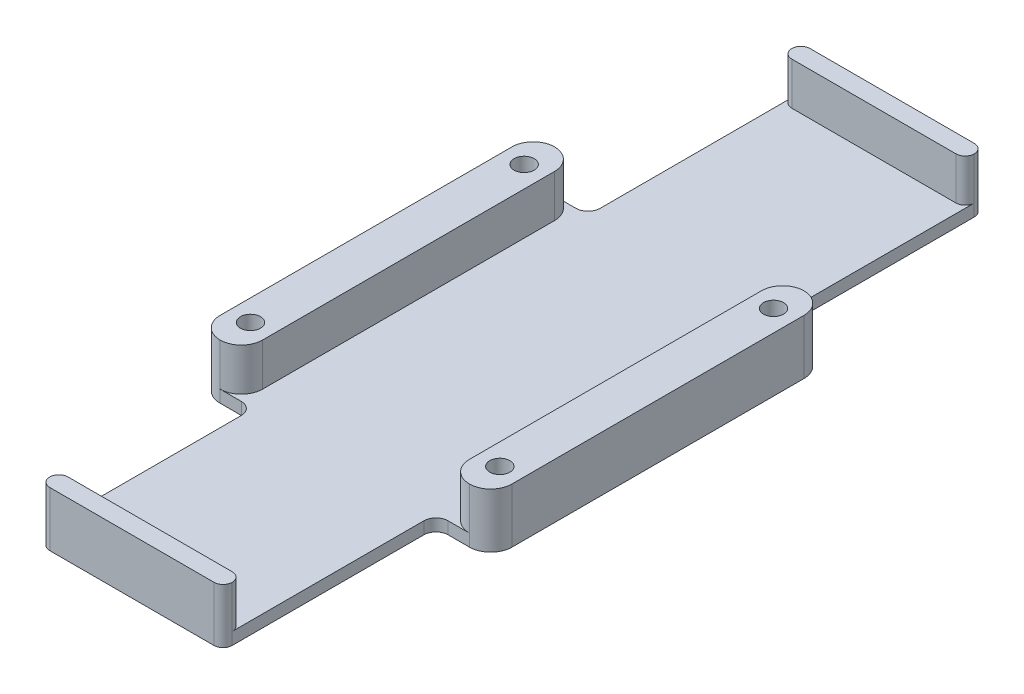
from build123d import *

# Parameters (mm, degrees)
SKETCH_1_W             = 48
SKETCH_1_H             = 125
EXTRUDE_403_DEPTH      = 2
SKETCH_2_W             = 9
SKETCH_2_H             = 35
CUT_EXTRUDE_733_DEPTH  = 67.979474468
SKETCH_3_W             = 7
SKETCH_3_H             = 55
EXTRUDE_1088_DEPTH     = 7
SKETCH_4_W             = 30
SKETCH_4_H             = 3
EXTRUDE_1396_DEPTH     = 7
SKETCH_5_R             = 1.65
CUT_EXTRUDE_1704_DEPTH = 68.551831951
SKETCH_7_R             = 3
CUT_EXTRUDE_2019_DEPTH = 4
CHAMFER_1_SIZE         = 1.5
FILLET_1_R             = 1.5
FILLET_2_R             = 2
FILLET_3_R             = 3.5


# Some blends are built 0.0001 mm under size
with BuildPart() as part:
    # Эскиз1 → Extrude 403 (new body)
    with BuildSketch(Plane(origin=(0, 0, 0), x_dir=(1, 0, 0), z_dir=(0, 1, 0))):
        Rectangle(SKETCH_1_W, SKETCH_1_H)
    extrude(amount=EXTRUDE_403_DEPTH)

    # Эскиз2 → Cut-Extrude 733 (cut, through all)
    with BuildSketch(Plane(origin=(0, 2, 0), x_dir=(1, 0, 0), z_dir=(0, 1, 0))):
        with Locations((-19.5, 45)):
            Rectangle(SKETCH_2_W, SKETCH_2_H)
        with Locations((19.5, 45)):
            Rectangle(SKETCH_2_W, SKETCH_2_H)
        with Locations((19.5, -45)):
            Rectangle(SKETCH_2_W, SKETCH_2_H)
        with Locations((-19.5, -45)):
            Rectangle(SKETCH_2_W, SKETCH_2_H)
    extrude(amount=-CUT_EXTRUDE_733_DEPTH, mode=Mode.SUBTRACT)

    # Эскиз3 → Extrude 1088 (add)
    with BuildSketch(Plane(origin=(0, 2, 0), x_dir=(1, 0, 0), z_dir=(0, 1, 0))):
        with Locations((-20.5, 0)):
            Rectangle(SKETCH_3_W, SKETCH_3_H)
        with Locations((20.5, 0)):
            Rectangle(SKETCH_3_W, SKETCH_3_H)
    extrude(amount=EXTRUDE_1088_DEPTH)

    # Эскиз4 → Extrude 1396 (add)
    with BuildSketch(Plane(origin=(0, 2, 0), x_dir=(1, 0, 0), z_dir=(0, 1, 0))):
        with Locations((0, 61)):
            Rectangle(SKETCH_4_W, SKETCH_4_H)
        with Locations((0, -61)):
            Rectangle(SKETCH_4_W, SKETCH_4_H)
    extrude(amount=EXTRUDE_1396_DEPTH)

    # Эскиз5 → Cut-Extrude 1704 (cut, through all)
    with BuildSketch(Plane(origin=(0, 9, 0), x_dir=(1, 0, 0), z_dir=(0, 1, 0))):
        with Locations(Location((-20.5, 22.5, 0), (0, 0, 270))):
            Circle(SKETCH_5_R)
        with Locations(Location((-20.5, -22.5, 0), (0, 0, 270))):
            Circle(SKETCH_5_R)
        with Locations(Location((20.5, -22.5, 0), (0, 0, 270))):
            Circle(SKETCH_5_R)
        with Locations(Location((20.5, 22.5, 0), (0, 0, 270))):
            Circle(SKETCH_5_R)
    extrude(amount=-CUT_EXTRUDE_1704_DEPTH, mode=Mode.SUBTRACT)

    # Эскиз7 → Cut-Extrude 2019 (cut)
    with BuildSketch(Plane.XZ):
        with Locations(Location((-20.5, 22.5, 0), (0, 0, 270))):
            Circle(SKETCH_7_R)
        with Locations(Location((-20.5, -22.5, 0), (0, 0, 270))):
            Circle(SKETCH_7_R)
        with Locations(Location((20.5, 22.5, 0), (0, 0, 270))):
            Circle(SKETCH_7_R)
        with Locations(Location((20.5, -22.5, 0), (0, 0, 270))):
            Circle(SKETCH_7_R)
    extrude(amount=-CUT_EXTRUDE_2019_DEPTH, mode=Mode.SUBTRACT)

    # Фаска1
    # the kernel refuses this chamfer: 1.5 mm, written as the material it takes off along each edge
    with BuildSketch(Plane(origin=(-20.5, 4, 22.5), x_dir=(0, 0, 1), z_dir=(-1, 0, 0))) as chamfer_1_piece_1_section:
        Polygon((1.65 + CHAMFER_1_SIZE, 0), (1.65, CHAMFER_1_SIZE), (1.65, 0), align=None)
    chamfer_1_piece_1 = revolve(axis=Axis((-20.5, 4, 22.5), (0, 1, 0)), mode=Mode.PRIVATE)
    chamfer_1_piece_1 = chamfer_1_piece_1 & Plane(origin=(-20.5, 4.828305934, 22.5), x_dir=(0, 0, -1), z_dir=(0, -1, 0)) * Cylinder(3, 13, mode=Mode.PRIVATE)
    add(chamfer_1_piece_1, mode=Mode.SUBTRACT)
    with BuildSketch(Plane(origin=(-20.5, 4, -22.5), x_dir=(0, 0, 1), z_dir=(-1, 0, 0))) as chamfer_1_piece_2_section:
        Polygon((1.65 + CHAMFER_1_SIZE, 0), (1.65, CHAMFER_1_SIZE), (1.65, 0), align=None)
    chamfer_1_piece_2 = revolve(axis=Axis((-20.5, 4, -22.5), (0, 1, 0)), mode=Mode.PRIVATE)
    chamfer_1_piece_2 = chamfer_1_piece_2 & Plane(origin=(-20.5, 4.828305934, -22.5), x_dir=(0, 0, -1), z_dir=(0, -1, 0)) * Cylinder(3, 13, mode=Mode.PRIVATE)
    add(chamfer_1_piece_2, mode=Mode.SUBTRACT)
    with BuildSketch(Plane(origin=(20.5, 4, -22.5), x_dir=(0, 0, 1), z_dir=(-1, 0, 0))) as chamfer_1_piece_3_section:
        Polygon((1.65 + CHAMFER_1_SIZE, 0), (1.65, CHAMFER_1_SIZE), (1.65, 0), align=None)
    chamfer_1_piece_3 = revolve(axis=Axis((20.5, 4, -22.5), (0, 1, 0)), mode=Mode.PRIVATE)
    chamfer_1_piece_3 = chamfer_1_piece_3 & Plane(origin=(20.5, 4.828305934, -22.5), x_dir=(0, 0, -1), z_dir=(0, -1, 0)) * Cylinder(3, 13, mode=Mode.PRIVATE)
    add(chamfer_1_piece_3, mode=Mode.SUBTRACT)
    with BuildSketch(Plane(origin=(20.5, 4, 22.5), x_dir=(0, 0, 1), z_dir=(-1, 0, 0))) as chamfer_1_piece_4_section:
        Polygon((1.65 + CHAMFER_1_SIZE, 0), (1.65, CHAMFER_1_SIZE), (1.65, 0), align=None)
    chamfer_1_piece_4 = revolve(axis=Axis((20.5, 4, 22.5), (0, 1, 0)), mode=Mode.PRIVATE)
    chamfer_1_piece_4 = chamfer_1_piece_4 & Plane(origin=(20.5, 4.828305934, 22.5), x_dir=(0, 0, -1), z_dir=(0, -1, 0)) * Cylinder(3, 13, mode=Mode.PRIVATE)
    add(chamfer_1_piece_4, mode=Mode.SUBTRACT)

    # Скругление1
    fillet_1_edges = [part.edges().sort_by_distance(p)[0] for p in [
        (-15, 5.5, 59.5),
        (-15, 4.5, 62.5),
        (15, 4.5, 62.5),
        (15, 5.5, 59.5),
        (15, 4.5, -62.5),
        (15, 5.5, -59.5),
        (-15, 5.5, -59.5),
        (-15, 4.5, -62.5),
    ]]
    fillet(fillet_1_edges, radius=FILLET_1_R - 0.0001)  # a hair under: the kernel refuses the full size

    # Скругление2
    fillet_2_edges = [part.edges().sort_by_distance(p)[0] for p in [
        (15, 1, -27.5),
        (-15, 1, -27.5),
        (-15, 1, 27.5),
        (15, 1, 27.5),
    ]]
    fillet(fillet_2_edges, radius=FILLET_2_R)

    # Скругление3
    fillet_3_edges = [part.edges().sort_by_distance(p)[0] for p in [
        (-17, 5.5, 27.5),
        (-24, 4.5, 27.5),
        (-24, 4.5, -27.5),
        (-17, 5.5, -27.5),
        (24, 4.5, -27.5),
        (17, 5.5, -27.5),
        (17, 5.5, 27.5),
        (24, 4.5, 27.5),
    ]]
    fillet(fillet_3_edges, radius=FILLET_3_R - 0.0001)  # a hair under: the kernel refuses the full size


solid = part.part
